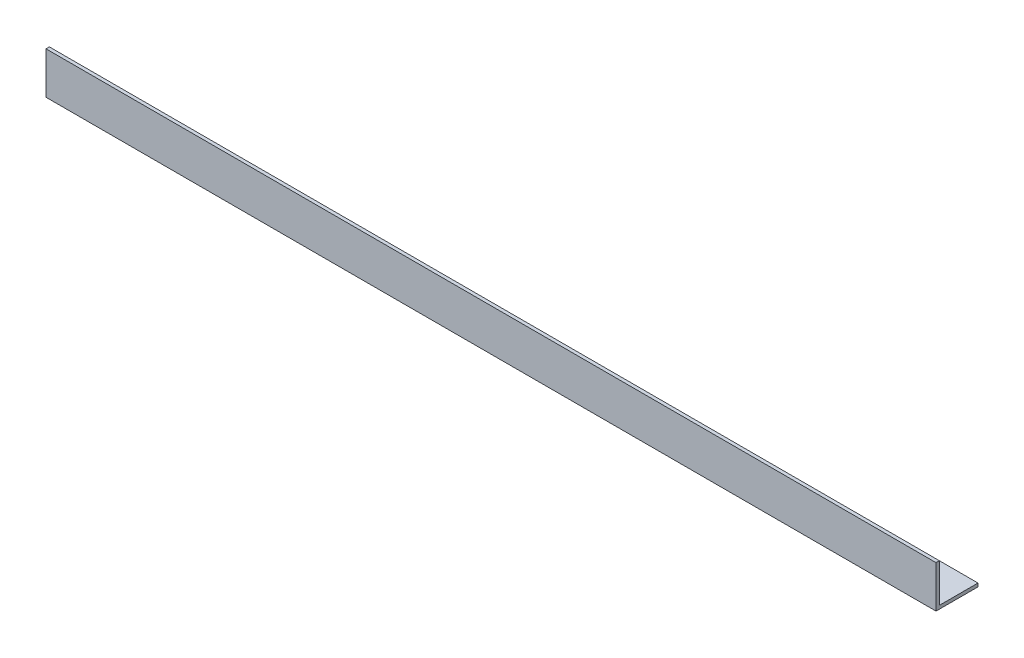
from build123d import *

# Parameters (mm, degrees)
EXTRUDE_1_DEPTH = 530


with BuildPart() as part:
    # Эскиз1 → Вытянуть-Тонкостенный1 (new body)
    with BuildSketch(Plane(origin=(0, 0, 0), x_dir=(0, 0, -1), z_dir=(1, 0, 0))):
        Polygon((0, 25), (0, 0), (25, 0), (25, 2), (2, 2), (2, 25), align=None)
    extrude(amount=EXTRUDE_1_DEPTH)


solid = part.part
